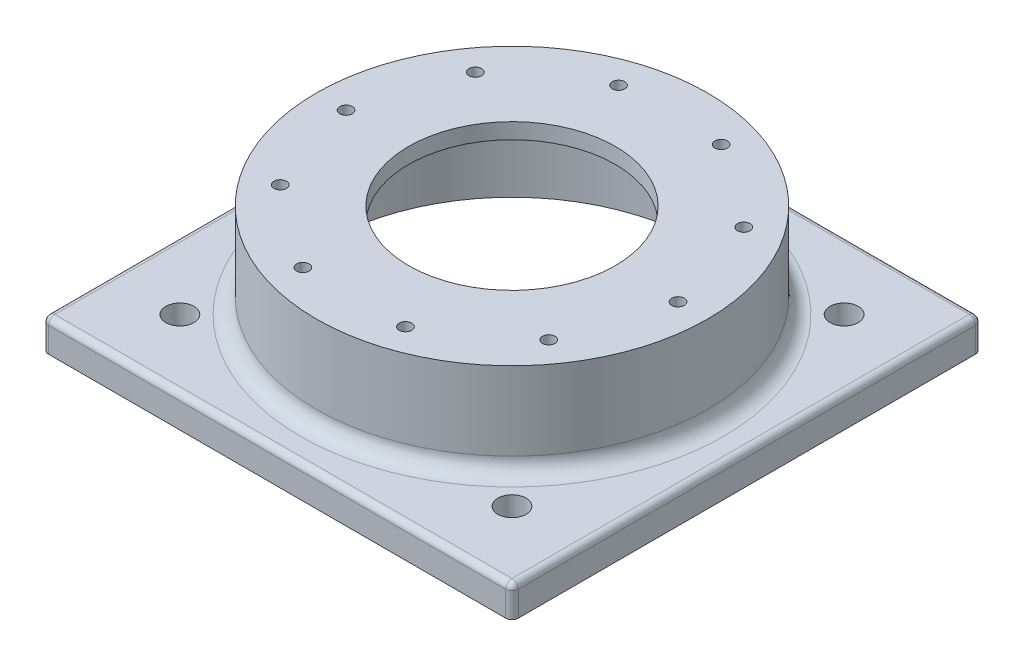
from build123d import *

# Parameters (mm, degrees)
SKETCH_1_W          = 150
SKETCH_1_H          = 150
SKETCH_1_R          = 4.5
EXTRUDE_1_DEPTH     = 10
FILLET_1_R          = 2
FILLET_2_R          = 2
SKETCH_4_R          = 62.5
EXTRUDE_4_DEPTH     = 30
FILLET_5_R          = 5
SKETCH_11_R         = 33
CUT_EXTRUDE_2_DEPTH = 114.357840488
SKETCH_10_R         = 60
CUT_EXTRUDE_3_DEPTH = 35
SKETCH_12_R         = 2
CUT_EXTRUDE_4_DEPTH = 114.357840488


with BuildPart() as part:
    # Эскиз1 → Бобышка-Вытянуть1 (new body)
    with BuildSketch(Plane(origin=(0, 0, 0), x_dir=(1, 0, 0), z_dir=(0, 1, 0))):
        Rectangle(SKETCH_1_W, SKETCH_1_H)
        with Locations((53.033008589, 53.033008589)):
            Circle(SKETCH_1_R, mode=Mode.SUBTRACT)
        with Locations((53.033008589, -53.033008589)):
            Circle(SKETCH_1_R, mode=Mode.SUBTRACT)
        with Locations((-53.033008589, -53.033008589)):
            Circle(SKETCH_1_R, mode=Mode.SUBTRACT)
        with Locations((-53.033008589, 53.033008589)):
            Circle(SKETCH_1_R, mode=Mode.SUBTRACT)
    extrude(amount=EXTRUDE_1_DEPTH)

    # Скругление1
    fillet_1_edges = [part.edges().sort_by_distance(p)[0] for p in [
        (-75, 5, -75),
        (75, 5, -75),
        (-75, 5, 75),
        (75, 5, 75),
    ]]
    fillet(fillet_1_edges, radius=FILLET_1_R)

    # Скругление2
    fillet_2_edges = [part.edges().sort_by_distance(p)[0] for p in [
        (-74.414213562, 10, -74.414213562),
        (74.414213562, 10, -74.414213562),
        (74.414213562, 10, 74.414213562),
        (-74.414213562, 10, 74.414213562),
        (0, 10, 75),
        (75, 10, 0),
        (0, 10, -75),
        (-75, 10, 0),
    ]]
    fillet(fillet_2_edges, radius=FILLET_2_R)

    # Эскиз4 → Бобышка-Вытянуть4 (add)
    with BuildSketch(Plane(origin=(0, 10, 0), x_dir=(1, 0, 0), z_dir=(0, 1, 0))):
        Circle(SKETCH_4_R)
    extrude(amount=EXTRUDE_4_DEPTH)

    # Скругление5
    fillet_5_edges = [part.edges().sort_by_distance(p)[0] for p in [
        (-62.5, 10, 0),
    ]]
    fillet(fillet_5_edges, radius=FILLET_5_R)

    # Эскиз11 → Вырез-Вытянуть2 (cut, through all)
    with BuildSketch(Plane(origin=(0, 40, 0), x_dir=(1, 0, 0), z_dir=(0, 1, 0))):
        Circle(SKETCH_11_R)
    extrude(amount=-CUT_EXTRUDE_2_DEPTH, mode=Mode.SUBTRACT)

    # Эскиз10 → Вырез-Вытянуть3 (cut)
    with BuildSketch(Plane.XZ):
        Circle(SKETCH_10_R)
    extrude(amount=-CUT_EXTRUDE_3_DEPTH, mode=Mode.SUBTRACT)

    # Эскиз12 → Вырез-Вытянуть4 (cut, through all)
    with BuildSketch(Plane(origin=(0, 40, 0), x_dir=(1, 0, 0), z_dir=(0, 1, 0))):
        with Locations((-53, 0)):
            Circle(SKETCH_12_R)
        with Locations((-42.877900702, 31.152618372)):
            Circle(SKETCH_12_R)
        with Locations((-16.377900702, 50.405995364)):
            Circle(SKETCH_12_R)
        with Locations((16.377900702, 50.405995364)):
            Circle(SKETCH_12_R)
        with Locations((42.877900702, 31.152618372)):
            Circle(SKETCH_12_R)
        with Locations((53, 0)):
            Circle(SKETCH_12_R)
        with Locations((42.877900702, -31.152618372)):
            Circle(SKETCH_12_R)
        with Locations((16.377900702, -50.405995364)):
            Circle(SKETCH_12_R)
        with Locations((-16.377900702, -50.405995364)):
            Circle(SKETCH_12_R)
        with Locations((-42.877900702, -31.152618372)):
            Circle(SKETCH_12_R)
    extrude(amount=-CUT_EXTRUDE_4_DEPTH, mode=Mode.SUBTRACT)


solid = part.part
